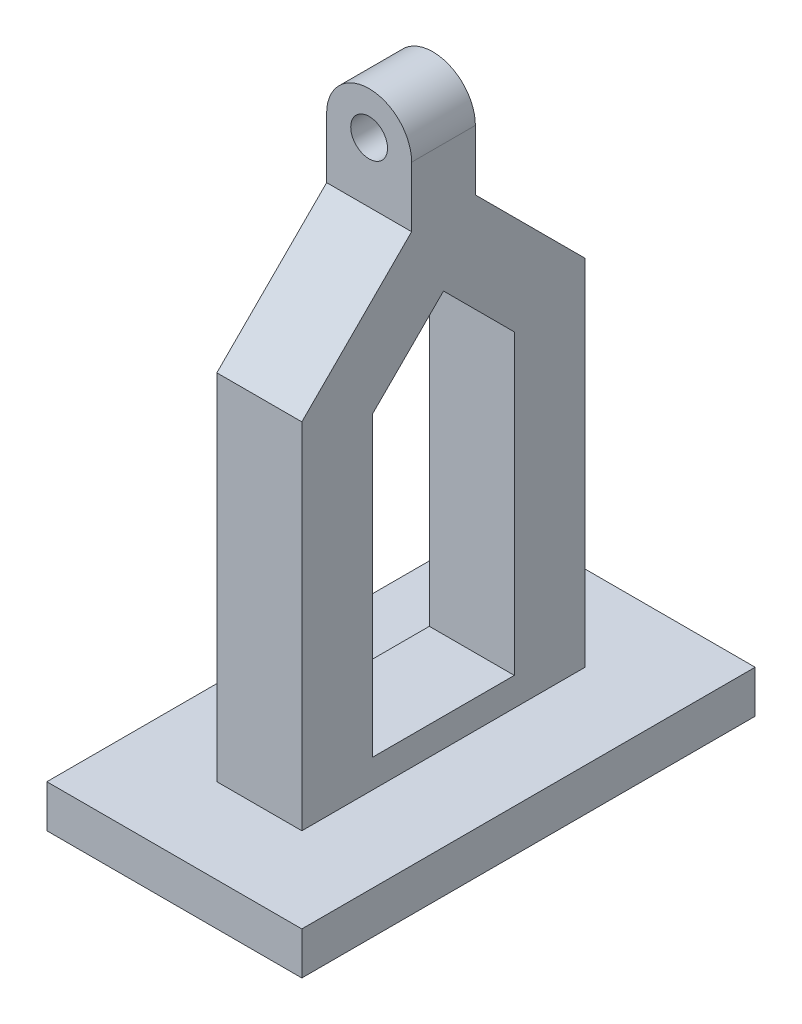
from build123d import *

# Parameters (mm, degrees)
SKETCH2_W            = 25.4
SKETCH2_H            = 48.26
BOSS_EXTRUDE1_DEPTH  = 3.81
SKETCH5_W            = 12.7
SKETCH5_H            = 33.02
CUT_EXTRUDE2_DEPTH   = 51.481501562
SKETCH4_W            = 22.86
SKETCH4_H            = 40.64
BOSS_EXTRUDE3_DEPTH  = 3.81
CHAMFER1_SIZE        = 6.35
SKETCH9_W            = 7.62
SKETCH9_H            = 6.35
BOSS_EXTRUDE4_DEPTH  = 2.8575
M3_CLEARANCE_HOLE1_D = 3.3
CHAMFER2_SIZE        = 12.7
CUT_EXTRUDE3_START   = -15.5575
CUT_EXTRUDE3_DEPTH   = 5.715


# Read off the part's stored shape, not the designer's step: Cut-Extrude3
# Some blends are built 0.0001 mm under size
with BuildPart() as part:
    # Sketch2 → Boss-Extrude1 (new, symmetric)
    with BuildSketch(Plane(origin=(0, 0, 0), x_dir=(0, 0, -1), z_dir=(1, 0, 0))):
        with Locations((0, 24.13)):
            Rectangle(SKETCH2_W, SKETCH2_H)
    extrude(amount=BOSS_EXTRUDE1_DEPTH, both=True)

    # Sketch5 → Cut-Extrude2 (cut, through all)
    with BuildSketch(Plane(origin=(3.81, 0, 0), x_dir=(0, 0, -1), z_dir=(1, 0, 0))):
        with Locations((0, 22.86)):
            Rectangle(SKETCH5_W, SKETCH5_H)
    extrude(amount=-CUT_EXTRUDE2_DEPTH, mode=Mode.SUBTRACT)

    # Sketch4 → Boss-Extrude3 (add)
    with BuildSketch(Plane(origin=(0, 0, 0), x_dir=(1, 0, 0), z_dir=(0, 1, 0))):
        Rectangle(SKETCH4_W, SKETCH4_H)
    extrude(amount=BOSS_EXTRUDE3_DEPTH)

    # Chamfer1
    chamfer1_edges = [part.edges().sort_by_distance(p)[0] for p in [
        (0, 39.37, 6.35),
        (0, 39.37, -6.35),
    ]]
    chamfer(chamfer1_edges, length=CHAMFER1_SIZE - 0.0001)  # a hair under: the kernel refuses the full size

    # Sketch9 → Boss-Extrude4 (add, symmetric)
    with BuildSketch(Plane.XY):
        with Locations((0, 51.435)):
            Rectangle(SKETCH9_W, SKETCH9_H)
    extrude(amount=BOSS_EXTRUDE4_DEPTH, both=True)

    # M3 Clearance Hole1 (through all)
    with Locations(Plane(origin=(0, 0, -12.7), x_dir=(-1, 0, 0), z_dir=(0, 0, -1))):
        with Locations((0, 50.8)):
            Hole(M3_CLEARANCE_HOLE1_D / 2)

    # Chamfer2
    # the kernel refuses this chamfer: 12.7 mm, written as the material it takes off along each edge
    with BuildSketch(Plane(origin=(36.470373947, 48.26, -12.7), x_dir=(0, -0.9996219169112966, -0.0274958766105866), z_dir=(-1, 0, 0))) as chamfer2_piece_1_section:
        Polygon((CHAMFER2_SIZE * 0.999621916911, CHAMFER2_SIZE * 0.0274958766106), (-CHAMFER2_SIZE * 0.0274958766106, CHAMFER2_SIZE * 0.999621916911), (0, 0), align=None)
    chamfer2_piece_1 = extrude(amount=72.940747894, mode=Mode.PRIVATE)
    chamfer2_piece_1 = split(chamfer2_piece_1, bisect_by=Plane(origin=(0, 43.83103101, -2.8575), z_dir=(0, 0, -1)), keep=Keep.TOP, mode=Mode.PRIVATE)
    add(chamfer2_piece_1, mode=Mode.SUBTRACT)
    with BuildSketch(Plane(origin=(-36.470373947, 48.26, 12.7), x_dir=(0, 0.02749587661058674, -0.9996219169112966), z_dir=(1, 0, 0))) as chamfer2_piece_2_section:
        Polygon((CHAMFER2_SIZE * 0.999621916911, -CHAMFER2_SIZE * 0.0274958766106), (-CHAMFER2_SIZE * 0.0274958766106, -CHAMFER2_SIZE * 0.999621916911), (0, 0), align=None)
    chamfer2_piece_2 = extrude(amount=72.940747894, mode=Mode.PRIVATE)
    chamfer2_piece_2 = split(chamfer2_piece_2, bisect_by=Plane(origin=(0, 43.83103101, 2.8575), z_dir=(0, 0, 1)), keep=Keep.TOP, mode=Mode.PRIVATE)
    add(chamfer2_piece_2, mode=Mode.SUBTRACT)

    # Cut-Extrude3 outline → Cut-Extrude3 (cut)
    with BuildSketch(Plane.XY.offset(12.7).offset(CUT_EXTRUDE3_START)):
        with BuildLine():
            Line((-3.81, 54.61), (-3.81, 50.8))
            ThreePointArc((-3.81, 50.8), (-2.694076836, 53.494076836), (0, 54.61))
            Line((0, 54.61), (-3.81, 54.61))
        make_face()
        with BuildLine():
            Line((3.81, 54.61), (0, 54.61))
            ThreePointArc((0, 54.61), (2.694076836, 53.494076836), (3.81, 50.8))
            Line((3.81, 50.8), (3.81, 54.61))
        make_face()
    extrude(amount=CUT_EXTRUDE3_DEPTH, mode=Mode.SUBTRACT)


solid = part.part
